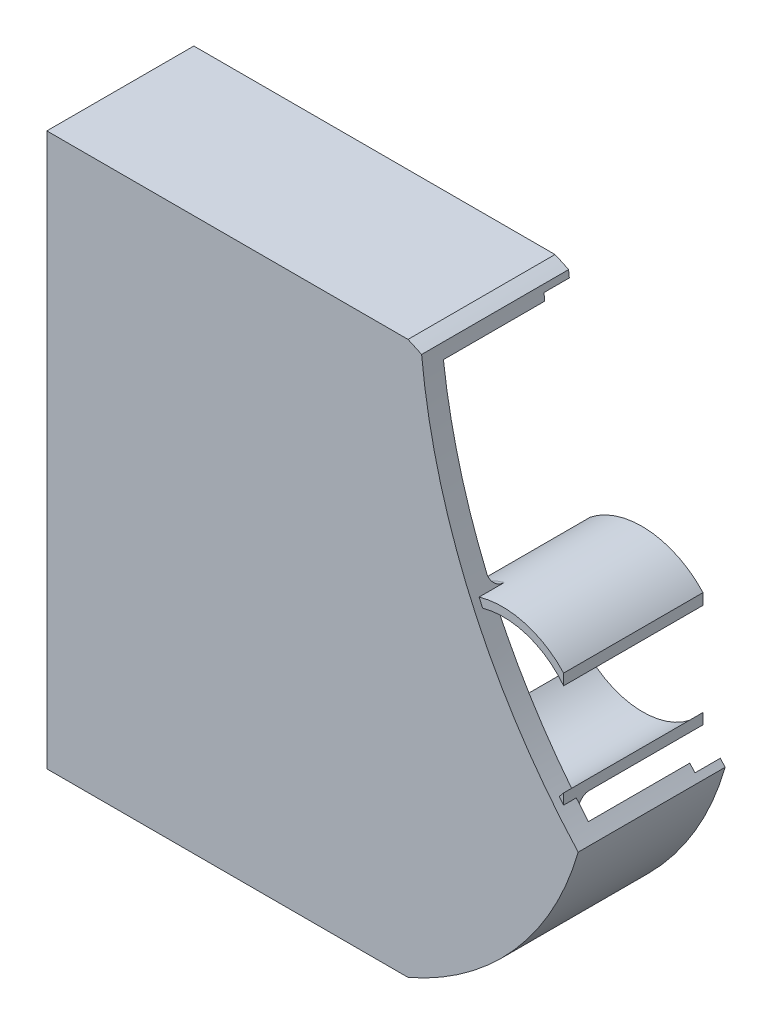
from build123d import *

# Parameters (mm, degrees)
SKETCH1_W                = 25
SKETCH1_H                = 40
BOSS_EXTRUDE1_DEPTH      = 8
BOSS_EXTRUDE5_DEPTH      = 10.6
BOSS_EXTRUDE5_DEPTH_BACK = 1
CUT_EXTRUDE2_DEPTH       = 9
CUT_EXTRUDE2_DEPTH_BACK  = 6
BOSS_EXTRUDE9_DEPTH      = 10
BOSS_EXTRUDE9_DEPTH_BACK = 1
CUT_EXTRUDE3_DEPTH       = 1
CUT_EXTRUDE3_DEPTH_BACK  = 1
FILLET8_R                = 1
FILLET10_R               = 1


with BuildPart() as part:
    # Sketch1 → Boss-Extrude1 (new body)
    with BuildSketch(Plane.XY):
        with Locations((-61.729654626, 25.727532329)):
            Rectangle(SKETCH1_W, SKETCH1_H)
    extrude(amount=BOSS_EXTRUDE1_DEPTH)

    # Sketch2 → Boss-Extrude5 (add, two sides: drawn at the far end of the back side and taken through both)
    with BuildSketch(Plane.XY.offset(-BOSS_EXTRUDE5_DEPTH_BACK)):
        with BuildLine():
            Line((-49.388759409, 47.527532329), (-77.888759409, 47.527532329))
            Line((-77.888759409, 47.527532329), (-77.888759409, 3.927532329))
            Line((-77.888759409, 3.927532329), (-49.388759409, 3.927532329))
            ThreePointArc((-49.388759409, 3.927532329), (-40.957549656, 10.053283106), (-35.962395161, 19.199788015))
            ThreePointArc((-35.962395161, 19.199788015), (-44.377897478, 32.123174473), (-48.316939051, 47.033524847))
            ThreePointArc((-48.316939051, 47.033524847), (-48.84977886, 47.287190199), (-49.388759409, 47.527532329))
        make_face()
    extrude(amount=BOSS_EXTRUDE5_DEPTH + BOSS_EXTRUDE5_DEPTH_BACK)

    # Sketch8 → Cut-Extrude2 (cut, two sides: drawn at the far end of the back side and taken through both)
    with BuildSketch(Plane.XY.offset(-CUT_EXTRUDE2_DEPTH_BACK)):
        with BuildLine():
            Line((-76.888759409, 46.527532329), (-76.888759409, 4.927532329))
            Line((-76.888759409, 4.927532329), (-49.388759409, 4.927532329))
            ThreePointArc((-49.388759409, 4.927532329), (-36.047275566, 25.727532329), (-49.388759409, 46.527532329))
            Line((-49.388759409, 46.527532329), (-76.888759409, 46.527532329))
        make_face()
    extrude(amount=CUT_EXTRUDE2_DEPTH + CUT_EXTRUDE2_DEPTH_BACK, mode=Mode.SUBTRACT)

    # Sketch9 → Boss-Extrude9 (add, two sides: drawn at the far end of the back side and taken through both)
    with BuildSketch(Plane.XY.offset(-BOSS_EXTRUDE9_DEPTH_BACK)):
        with BuildLine():
            Line((-37.709306063, 30.262523401), (-37.709306063, 29.391558822))
            ThreePointArc((-37.709306063, 29.391558822), (-42.003219762, 31.714307994), (-46.602233885, 30.07664879))
            Line((-46.602233885, 30.07664879), (-46.602233885, 30.974503727))
            ThreePointArc((-46.602233885, 30.974503727), (-42.015807763, 32.36669928), (-37.709306063, 30.262523401))
        make_face()
        with BuildLine():
            Line((-37.709306063, 22.074162076), (-37.709306063, 21.227989818))
            ThreePointArc((-37.709306063, 21.227989818), (-42.041689553, 19.191758771), (-46.602233885, 20.64682543))
            Line((-46.602233885, 20.64682543), (-46.602233885, 21.378415869))
            ThreePointArc((-46.602233885, 21.378415869), (-42.000825501, 19.745811029), (-37.709306063, 22.074162076))
        make_face()
    extrude(amount=BOSS_EXTRUDE9_DEPTH + BOSS_EXTRUDE9_DEPTH_BACK)

    # Sketch10 → Cut-Extrude3 (cut, two sides: drawn at the far end of the back side and taken through both)
    with BuildSketch(Plane.XY.offset(-CUT_EXTRUDE3_DEPTH_BACK)):
        with BuildLine():
            Line((-76.888759409, 47.027532329), (-49.388759409, 47.027532329))
            ThreePointArc((-49.388759409, 47.027532329), (-35.532634704, 25.727532329), (-49.388759409, 4.427532329))
            Line((-49.388759409, 4.427532329), (-77.388759409, 4.427532329))
            Line((-77.388759409, 4.427532329), (-77.388759409, 47.027532329))
            Line((-77.388759409, 47.027532329), (-76.888759409, 47.027532329))
        make_face()
        with BuildLine():
            Line((-49.388759409, 46.527532329), (-76.888759409, 46.527532329))
            Line((-76.888759409, 46.527532329), (-76.888759409, 4.927532329))
            Line((-76.888759409, 4.927532329), (-49.388759409, 4.927532329))
            ThreePointArc((-49.388759409, 4.927532329), (-36.047275566, 25.727532329), (-49.388759409, 46.527532329))
        make_face(mode=Mode.SUBTRACT)
    extrude(amount=CUT_EXTRUDE3_DEPTH + CUT_EXTRUDE3_DEPTH_BACK, mode=Mode.SUBTRACT)

    # Fillet8
    fillet8_edges = [part.edges().sort_by_distance(p)[0] for p in [
        (-45.54565634, 31.656454521, 9),
    ]]
    fillet(fillet8_edges, radius=FILLET8_R)

    # Fillet10
    fillet10_edges = [part.edges().sort_by_distance(p)[0] for p in [
        (-42.041689553, 19.191758771, 9),
    ]]
    fillet(fillet10_edges, radius=FILLET10_R)


solid = part.part
